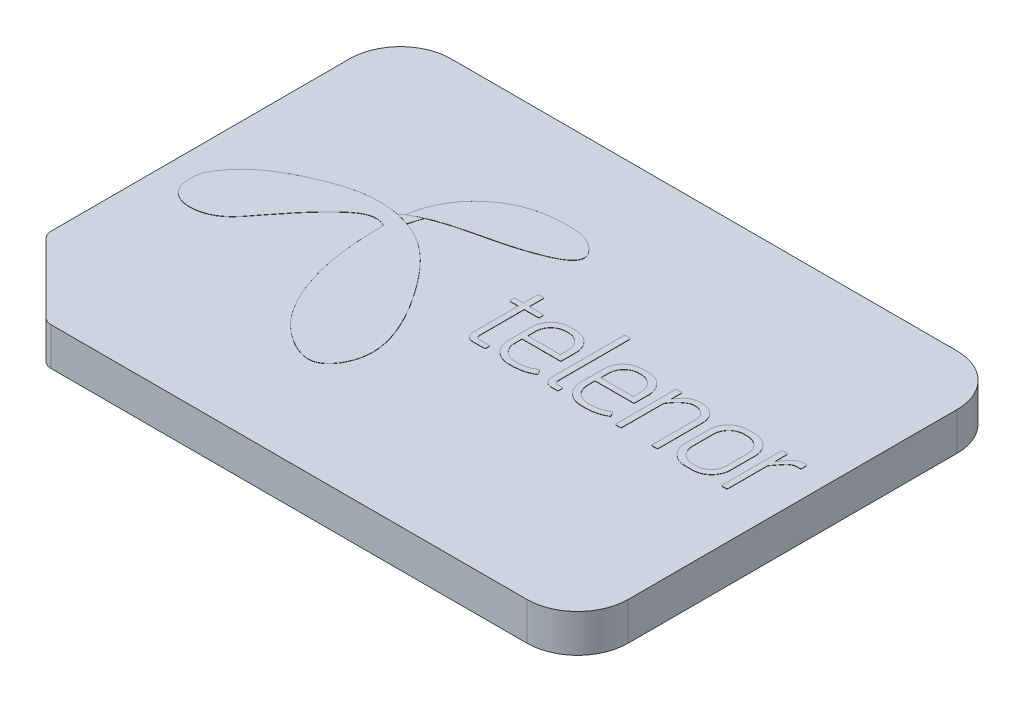
from build123d import *

# Parameters (mm, degrees)
BOSS_EXTRUDE1_DEPTH = 0.75
CUT_EXTRUDE1_DEPTH  = 0.01
SKETCH4_W           = 3.5
SKETCH4_H           = 2.5
BOSS_EXTRUDE2_DEPTH = 0.02
BOSS_EXTRUDE3_DEPTH = 0.005
BOSS_EXTRUDE4_DEPTH = 0.004
BOSS_EXTRUDE5_DEPTH = 0.005
FILLET1_START       = 0.75
FILLET1_DEPTH       = 0.0051251


with BuildPart() as part:
    # Sketch1 → Boss-Extrude1 (new body)
    with BuildSketch(Plane(origin=(0, 0, 0), x_dir=(1, 0, 0), z_dir=(0, 1, 0))):
        with BuildLine():
            Line((-5.867245437, -2.86539128), (-4.513692046, -4.21894467))
            ThreePointArc((-4.513692046, -4.21894467), (-4.432586209, -4.273137858), (-4.336915351, -4.292167975))
            Line((-4.336915351, -4.292167975), (5.059531259, -4.292167975))
            ThreePointArc((5.059531259, -4.292167975), (5.76663804, -3.999274756), (6.059531259, -3.292167975))
            Line((6.059531259, -3.292167975), (6.059531259, 3.207832025))
            ThreePointArc((6.059531259, 3.207832025), (5.76663804, 3.914938806), (5.059531259, 4.207832025))
            Line((5.059531259, 4.207832025), (-4.940468741, 4.207832025))
            ThreePointArc((-4.940468741, 4.207832025), (-5.647575522, 3.914938806), (-5.940468741, 3.207832025))
            Line((-5.940468741, 3.207832025), (-5.940468741, -2.688614584))
            ThreePointArc((-5.940468741, -2.688614584), (-5.921438624, -2.784285442), (-5.867245437, -2.86539128))
        make_face()
    extrude(amount=BOSS_EXTRUDE1_DEPTH)

    # Sketch2 → Cut-Extrude1 (cut)
    with BuildSketch(Plane.XZ):
        with BuildLine():
            Line((-4, 4), (4, 4))
            ThreePointArc((4, 4), (5.060660172, 3.560660172), (5.5, 2.5))
            Line((5.5, 2.5), (5.5, -2.5))
            ThreePointArc((5.5, -2.5), (5.060660172, -3.560660172), (4, -4))
            Line((4, -4), (-4, -4))
            ThreePointArc((-4, -4), (-5.060660172, -3.560660172), (-5.5, -2.5))
            Line((-5.5, -2.5), (-5.5, 2.5))
            ThreePointArc((-5.5, 2.5), (-5.060660172, 3.560660172), (-4, 4))
        make_face()
    extrude(amount=-CUT_EXTRUDE1_DEPTH, mode=Mode.SUBTRACT)

    # Sketch4 → Boss-Extrude2 (add)
    with BuildSketch(Plane.XZ.offset(-0.01)):
        with BuildLine():
            Line((-1, 2.05), (-1, 2.717157288))
            ThreePointArc((-1, 2.717157288), (-1.030448187, 2.87023066), (-1.117157288, 3))
            Line((-1.117157288, 3), (-1.482842712, 3.365685425))
            ThreePointArc((-1.482842712, 3.365685425), (-1.569551813, 3.495454764), (-1.6, 3.648528137))
            Line((-1.6, 3.648528137), (-1.6, 3.8))
            Line((-1.6, 3.8), (1.6, 3.8))
            Line((1.6, 3.8), (1.6, 3.648528137))
            ThreePointArc((1.6, 3.648528137), (1.569551813, 3.495454764), (1.482842712, 3.365685425))
            Line((1.482842712, 3.365685425), (1.117157288, 3))
            ThreePointArc((1.117157288, 3), (1.030448187, 2.87023066), (1, 2.717157288))
            Line((1, 2.717157288), (1, 2.05))
            ThreePointArc((1, 2.05), (1.117157288, 1.767157288), (1.4, 1.65))
            ThreePointArc((1.4, 1.65), (1.541421356, 1.591421356), (1.6, 1.45))
            Line((1.6, 1.45), (1.6, -1.45))
            ThreePointArc((1.6, -1.45), (1.541421356, -1.591421356), (1.4, -1.65))
            ThreePointArc((1.4, -1.65), (1.117157288, -1.767157288), (1, -2.05))
            Line((1, -2.05), (1, -2.717157288))
            ThreePointArc((1, -2.717157288), (1.030448187, -2.87023066), (1.117157288, -3))
            Line((1.117157288, -3), (1.482842712, -3.365685425))
            ThreePointArc((1.482842712, -3.365685425), (1.569551813, -3.495454764), (1.6, -3.648528137))
            Line((1.6, -3.648528137), (1.6, -3.8))
            Line((1.6, -3.8), (-1.6, -3.8))
            Line((-1.6, -3.8), (-1.6, -3.648528137))
            ThreePointArc((-1.6, -3.648528137), (-1.569551813, -3.495454764), (-1.482842712, -3.365685425))
            Line((-1.482842712, -3.365685425), (-1.117157288, -3))
            ThreePointArc((-1.117157288, -3), (-1.030448187, -2.87023066), (-1, -2.717157288))
            Line((-1, -2.717157288), (-1, -2.05))
            ThreePointArc((-1, -2.05), (-1.117157288, -1.767157288), (-1.4, -1.65))
            ThreePointArc((-1.4, -1.65), (-1.541421356, -1.591421356), (-1.6, -1.45))
            Line((-1.6, -1.45), (-1.6, 1.45))
            ThreePointArc((-1.6, 1.45), (-1.541421356, 1.591421356), (-1.4, 1.65))
            ThreePointArc((-1.4, 1.65), (-1.117157288, 1.767157288), (-1, 2.05))
        make_face()
        with BuildLine():
            Line((-1.2, 2.05), (-1.2, 2.634314575))
            ThreePointArc((-1.2, 2.634314575), (-1.230448187, 2.787387948), (-1.317157288, 2.917157288))
            Line((-1.317157288, 2.917157288), (-1.624264069, 3.224264069))
            ThreePointArc((-1.624264069, 3.224264069), (-1.75432772, 3.418918078), (-1.8, 3.648528137))
            Line((-1.8, 3.648528137), (-1.8, 3.8))
            Line((-1.8, 3.8), (-4, 3.8))
            ThreePointArc((-4, 3.8), (-4.919238816, 3.419238816), (-5.3, 2.5))
            Line((-5.3, 2.5), (-5.3, 1.45))
            Line((-5.3, 1.45), (-1.8, 1.45))
            ThreePointArc((-1.8, 1.45), (-1.682842712, 1.732842712), (-1.4, 1.85))
            ThreePointArc((-1.4, 1.85), (-1.258578644, 1.908578644), (-1.2, 2.05))
        make_face()
        with Locations((-3.55, 0)):
            Rectangle(SKETCH4_W, SKETCH4_H)
        with BuildLine():
            Line((-5.3, -1.45), (-1.8, -1.45))
            ThreePointArc((-1.8, -1.45), (-1.682842712, -1.732842712), (-1.4, -1.85))
            ThreePointArc((-1.4, -1.85), (-1.258578644, -1.908578644), (-1.2, -2.05))
            Line((-1.2, -2.05), (-1.2, -2.634314575))
            ThreePointArc((-1.2, -2.634314575), (-1.230448187, -2.787387948), (-1.317157288, -2.917157288))
            Line((-1.317157288, -2.917157288), (-1.624264069, -3.224264069))
            ThreePointArc((-1.624264069, -3.224264069), (-1.75432772, -3.418918078), (-1.8, -3.648528137))
            Line((-1.8, -3.648528137), (-1.8, -3.8))
            Line((-1.8, -3.8), (-4, -3.8))
            ThreePointArc((-4, -3.8), (-4.919238816, -3.419238816), (-5.3, -2.5))
            Line((-5.3, -2.5), (-5.3, -1.45))
        make_face()
        with Locations((3.55, 0)):
            Rectangle(SKETCH4_W, SKETCH4_H)
        with BuildLine():
            Line((4, 3.8), (1.8, 3.8))
            Line((1.8, 3.8), (1.8, 3.648528137))
            ThreePointArc((1.8, 3.648528137), (1.75432772, 3.418918078), (1.624264069, 3.224264069))
            Line((1.624264069, 3.224264069), (1.317157288, 2.917157288))
            ThreePointArc((1.317157288, 2.917157288), (1.230448187, 2.787387948), (1.2, 2.634314575))
            Line((1.2, 2.634314575), (1.2, 2.05))
            ThreePointArc((1.2, 2.05), (1.258578644, 1.908578644), (1.4, 1.85))
            ThreePointArc((1.4, 1.85), (1.682842712, 1.732842712), (1.8, 1.45))
            Line((1.8, 1.45), (5.3, 1.45))
            Line((5.3, 1.45), (5.3, 2.5))
            ThreePointArc((5.3, 2.5), (4.919238816, 3.419238816), (4, 3.8))
        make_face()
        with BuildLine():
            Line((1.8, -3.8), (1.8, -3.648528137))
            ThreePointArc((1.8, -3.648528137), (1.75432772, -3.418918078), (1.624264069, -3.224264069))
            Line((1.624264069, -3.224264069), (1.317157288, -2.917157288))
            ThreePointArc((1.317157288, -2.917157288), (1.230448187, -2.787387948), (1.2, -2.634314575))
            Line((1.2, -2.634314575), (1.2, -2.05))
            ThreePointArc((1.2, -2.05), (1.258578644, -1.908578644), (1.4, -1.85))
            ThreePointArc((1.4, -1.85), (1.682842712, -1.732842712), (1.8, -1.45))
            Line((1.8, -1.45), (5.3, -1.45))
            Line((5.3, -1.45), (5.3, -2.5))
            ThreePointArc((5.3, -2.5), (4.919238816, -3.419238816), (4, -3.8))
            Line((4, -3.8), (1.8, -3.8))
        make_face()
    extrude(amount=BOSS_EXTRUDE2_DEPTH)

    # Sketch5 → Boss-Extrude3 (add)
    with BuildSketch(Plane(origin=(0, 0.75, 0), x_dir=(1, 0, 0), z_dir=(0, 1, 0))):
        with BuildLine():
            add(Edge.make_bspline(
                [(-2.746331249, 0.684151864), (-3.018239989, 0.82701914), (-3.564683242, 0.386731617), (-4.05681354, -0.232269927), (-4.67686219, -1.065183577), (-5.618099933, -0.941053145), (-5.431270149, -0.191830215)],
                knots=[0, 0, 0, 0, 0.204670793, 0.494379641, 0.653658296, 1, 1, 1, 1], degree=3))
            add(Edge.make_bspline(
                [(-5.431270149, -0.191830215), (-5.183392045, 0.308508675), (-4.445277857, 0.755332819), (-3.300795452, 1.142116003), (-2.15051283, 0.908557653), (-1.411768103, 0.052654454), (-0.833611503, -0.851243738), (-0.550300398, -1.729511808), (-1.083605068, -2.476394517), (-1.92229722, -2.096853033), (-2.621963661, -1.065535594), (-2.756354926, 0.025473446), (-2.746331249, 0.684151864)],
                knots=[0, 0, 0, 0, 0.143633998, 0.224551072, 0.32123149, 0.437928053, 0.514752059, 0.615897368, 0.662761045, 0.721217283, 0.819471934, 1, 1, 1, 1], degree=3))
        make_face()
        with BuildLine():
            add(Edge.make_bspline(
                [(-2.712331134, 1.088175469), (-2.322338812, 1.32598895), (-1.589483323, 1.458701264), (-0.82208368, 1.67013018), (-0.236360501, 1.920399994), (-0.193397974, 2.199987102), (-0.479535569, 2.492310562), (-1.1728854, 2.528715404), (-2.062599411, 2.345058126), (-2.654117546, 1.618896722), (-2.712331134, 1.08875865)],
                knots=[0.021028627, 0.021028627, 0.021028627, 0.021028627, 0.247946457, 0.361228738, 0.459844615, 0.477083349, 0.533616079, 0.606189141, 0.770601523, 1, 1, 1, 1], degree=3))
            Line((-2.712331134, 1.08875865), (-2.712331134, 1.088175469))
        make_face()
    extrude(amount=BOSS_EXTRUDE3_DEPTH)

    # Sketch7 → Boss-Extrude4 (add)
    with BuildSketch(Plane(origin=(0, 0.75, 0), x_dir=(1, 0, 0), z_dir=(0, 1, 0))):
        with BuildLine():
            add(Edge.make_bspline(
                [(-2.465592891, 1.215197057), (-2.513475678, 1.081757888), (-2.547122699, 0.944087382)],
                knots=[0, 0, 0, 1, 1, 1], degree=2))
            add(Edge.make_bspline(
                [(-2.818079937, 1.018084297), (-2.726042248, 0.999926402), (-2.635285786, 0.975200652), (-2.547122699, 0.944087382)],
                knots=[0.271335943, 0.271335943, 0.271335943, 0.271335943, 0.296118168, 0.296118168, 0.296118168, 0.296118168], degree=3))
            add(Edge.make_bspline(
                [(-2.818079937, 1.018084297), (-2.709072986, 1.096648665), (-2.590215165, 1.160965408), (-2.465592891, 1.215197057)],
                knots=[0, 0, 0, 0, 0.066799043, 0.066799043, 0.066799043, 0.066799043], degree=3))
        make_face()
    extrude(amount=BOSS_EXTRUDE4_DEPTH)

    # Sketch8 → Boss-Extrude5 (add)
    # profile 1 of 7: a face of its own
    with BuildSketch(Plane(origin=(0, 0.75, 0), x_dir=(1, 0, 0), z_dir=(0, 1, 0))):
        with BuildLine():
            Line((-0.039842098, 1.033211986), (-0.039842098, 0.738024425))
            Line((-0.039842098, 0.738024425), (-0.216792351, 0.738024425))
            Line((-0.216792351, 0.738024425), (-0.216792351, 0.637717972))
            Line((-0.216792351, 0.637717972), (-0.039842098, 0.637717972))
            Line((-0.039842098, 0.637717972), (-0.039842098, -0.26479863))
            ThreePointArc((-0.039842098, -0.26479863), (0.005556351, -0.374400181), (0.115157902, -0.41979863))
            Line((0.115157902, -0.41979863), (0.361847188, -0.41979863))
            Line((0.361847188, -0.41979863), (0.361847188, -0.322574834))
            Line((0.361847188, -0.322574834), (0.15339521, -0.322574834))
            ThreePointArc((0.15339521, -0.322574834), (0.100362202, -0.300607843), (0.07839521, -0.247574834))
            Line((0.07839521, -0.247574834), (0.07839521, 0.637717972))
            Line((0.07839521, 0.637717972), (0.367850974, 0.637717972))
            Line((0.367850974, 0.637717972), (0.367850974, 0.738024425))
            Line((0.367850974, 0.738024425), (0.07839521, 0.738024425))
            Line((0.07839521, 0.738024425), (0.07839521, 1.033211986))
            Line((0.07839521, 1.033211986), (-0.039842098, 1.033211986))
        make_face()
    # profile 2 of 7: a face of its own
    with BuildSketch(Plane(origin=(0, 0.75, 0), x_dir=(1, 0, 0), z_dir=(0, 1, 0))):
        with BuildLine():
            Line((0.560548029, 0.112189616), (1.325341981, 0.112189616))
            Line((1.325341981, 0.112189616), (1.325341981, 0.413114254))
            ThreePointArc((1.325341981, 0.413114254), (1.215507024, 0.678279297), (0.950341981, 0.788114254))
            Line((0.950341981, 0.788114254), (0.823262051, 0.788114254))
            ThreePointArc((0.823262051, 0.788114254), (0.558097008, 0.678279297), (0.448262051, 0.413114254))
            Line((0.448262051, 0.413114254), (0.448262051, -0.04677698))
            ThreePointArc((0.448262051, -0.04677698), (0.565419338, -0.329619693), (0.848262051, -0.44677698))
            Line((0.848262051, -0.44677698), (0.958233671, -0.44677698))
            add(Edge.make_bspline(
                [(0.958233671, -0.44677698), (1.090913429, -0.441307073), (1.214307268, -0.409288639), (1.324989539, -0.33683287)],
                knots=[0, 0, 0, 0, 1, 1, 1, 1], degree=3))
            Line((1.324989539, -0.33683287), (1.265309096, -0.237412416))
            add(Edge.make_bspline(
                [(0.860548029, -0.339308184), (1.079180057, -0.362555739), (1.265309096, -0.237412416)],
                knots=[0, 0, 0, 1, 1, 1], degree=2))
            ThreePointArc((0.860548029, -0.339308184), (0.648415995, -0.251440218), (0.560548029, -0.039308184))
            Line((0.560548029, -0.039308184), (0.560548029, 0.112189616))
        make_face()
        with BuildLine():
            Line((0.562831822, 0.221265893), (1.206858226, 0.221265893))
            Line((1.206858226, 0.221265893), (1.206858226, 0.378011969))
            ThreePointArc((1.206858226, 0.378011969), (1.118990261, 0.590144004), (0.906858226, 0.678011969))
            Line((0.906858226, 0.678011969), (0.862831822, 0.678011969))
            ThreePointArc((0.862831822, 0.678011969), (0.650699788, 0.590144004), (0.562831822, 0.378011969))
            Line((0.562831822, 0.378011969), (0.562831822, 0.221265893))
        make_face(mode=Mode.SUBTRACT)
    # profile 3 of 7: a face of its own
    with BuildSketch(Plane(origin=(0, 0.75, 0), x_dir=(1, 0, 0), z_dir=(0, 1, 0))):
        with BuildLine():
            Line((1.507907198, 1.192098568), (1.507907198, -0.26183691))
            ThreePointArc((1.507907198, -0.26183691), (1.554770113, -0.374973995), (1.667907198, -0.42183691))
            Line((1.667907198, -0.42183691), (1.803911943, -0.42183691))
            Line((1.803911943, -0.42183691), (1.803911943, -0.321909948))
            Line((1.803911943, -0.321909948), (1.704707185, -0.321909948))
            ThreePointArc((1.704707185, -0.321909948), (1.651674176, -0.299942956), (1.629707185, -0.246909948))
            Line((1.629707185, -0.246909948), (1.629707185, 1.192098568))
            Line((1.629707185, 1.192098568), (1.507907198, 1.192098568))
        make_face()
    # profile 4 of 7: a face of its own
    with BuildSketch(Plane(origin=(0, 0.75, 0), x_dir=(1, 0, 0), z_dir=(0, 1, 0))):
        with BuildLine():
            Line((2.941202589, 0.777370173), (2.941202589, -0.430933078))
            Line((2.941202589, -0.430933078), (3.060921969, -0.430933078))
            Line((3.060921969, -0.430933078), (3.060921969, 0.408363321))
            add(Edge.make_bspline(
                [(3.060921969, 0.408363321), (3.118709934, 0.500241405), (3.216691387, 0.622693218), (3.356731553, 0.677710895), (3.395041539, 0.678497314)],
                knots=[0, 0, 0, 0, 0.750567643, 1, 1, 1, 1], degree=3))
            Line((3.395041539, 0.678497314), (3.4256973, 0.678497314))
            ThreePointArc((3.4256973, 0.678497314), (3.58833186, 0.611131874), (3.6556973, 0.448497314))
            Line((3.6556973, 0.448497314), (3.6556973, -0.430933078))
            Line((3.6556973, -0.430933078), (3.778927534, -0.430933078))
            Line((3.778927534, -0.430933078), (3.778927534, 0.467379625))
            ThreePointArc((3.778927534, 0.467379625), (3.685201704, 0.693653795), (3.458927534, 0.787379625))
            Line((3.458927534, 0.787379625), (3.395041539, 0.787379625))
            add(Edge.make_bspline(
                [(3.060921969, 0.558322596), (3.112328489, 0.638924754), (3.21551659, 0.758180908), (3.353259431, 0.785707111), (3.395041539, 0.787379625)],
                knots=[0, 0, 0, 0, 0.714397336, 1, 1, 1, 1], degree=3))
            Line((3.060921969, 0.558322596), (3.060921969, 0.777370173))
            Line((3.060921969, 0.777370173), (2.941202589, 0.777370173))
        make_face()
    # profile 5 of 7: a face of its own
    with BuildSketch(Plane(origin=(0, 0.75, 0), x_dir=(1, 0, 0), z_dir=(0, 1, 0))):
        with BuildLine():
            Line((1.997875049, 0.116111152), (2.767209177, 0.116111152))
            Line((2.767209177, 0.116111152), (2.767209177, 0.410738787))
            ThreePointArc((2.767209177, 0.410738787), (2.65737422, 0.67590383), (2.392209177, 0.785738787))
            Line((2.392209177, 0.785738787), (2.253611647, 0.785738787))
            ThreePointArc((2.253611647, 0.785738787), (1.988446604, 0.67590383), (1.878611647, 0.410738787))
            Line((1.878611647, 0.410738787), (1.878611647, -0.042855444))
            ThreePointArc((1.878611647, -0.042855444), (1.995768935, -0.325698156), (2.278611647, -0.442855444))
            Line((2.278611647, -0.442855444), (2.395560691, -0.442855444))
            add(Edge.make_bspline(
                [(2.395560691, -0.442855444), (2.528240449, -0.437385537), (2.651634287, -0.405367103), (2.762316558, -0.332911334)],
                knots=[0, 0, 0, 0, 1, 1, 1, 1], degree=3))
            Line((2.762316558, -0.332911334), (2.702636115, -0.23349088))
            add(Edge.make_bspline(
                [(2.297875049, -0.335386648), (2.516507077, -0.358634203), (2.702636115, -0.23349088)],
                knots=[0, 0, 0, 1, 1, 1], degree=2))
            ThreePointArc((2.297875049, -0.335386648), (2.085743014, -0.247518682), (1.997875049, -0.035386648))
            Line((1.997875049, -0.035386648), (1.997875049, 0.116111152))
        make_face()
        with BuildLine():
            Line((2.000158842, 0.225187429), (2.644185246, 0.225187429))
            Line((2.644185246, 0.225187429), (2.644185246, 0.381933505))
            ThreePointArc((2.644185246, 0.381933505), (2.55631728, 0.59406554), (2.344185246, 0.681933505))
            Line((2.344185246, 0.681933505), (2.300158842, 0.681933505))
            ThreePointArc((2.300158842, 0.681933505), (2.088026807, 0.59406554), (2.000158842, 0.381933505))
            Line((2.000158842, 0.381933505), (2.000158842, 0.225187429))
        make_face(mode=Mode.SUBTRACT)
    # profile 6 of 7: a face of its own
    with BuildSketch(Plane(origin=(0, 0.75, 0), x_dir=(1, 0, 0), z_dir=(0, 1, 0))):
        with BuildLine():
            Line((4.333242587, -0.446302445), (4.488491677, -0.446302445))
            ThreePointArc((4.488491677, -0.446302445), (4.75365672, -0.336467488), (4.863491677, -0.071302445))
            Line((4.863491677, -0.071302445), (4.863491677, 0.412603377))
            ThreePointArc((4.863491677, 0.412603377), (4.75365672, 0.67776842), (4.488491677, 0.787603377))
            Line((4.488491677, 0.787603377), (4.333242587, 0.787603377))
            ThreePointArc((4.333242587, 0.787603377), (4.068077544, 0.67776842), (3.958242587, 0.412603377))
            Line((3.958242587, 0.412603377), (3.958242587, -0.071302445))
            ThreePointArc((3.958242587, -0.071302445), (4.068077544, -0.336467488), (4.333242587, -0.446302445))
        make_face()
        with BuildLine():
            Line((4.376970761, -0.341069535), (4.450508506, -0.341069535))
            ThreePointArc((4.450508506, -0.341069535), (4.66264054, -0.253201569), (4.750508506, -0.041069535))
            Line((4.750508506, -0.041069535), (4.750508506, 0.376191119))
            ThreePointArc((4.750508506, 0.376191119), (4.66264054, 0.588323153), (4.450508506, 0.676191119))
            Line((4.450508506, 0.676191119), (4.376970761, 0.676191119))
            ThreePointArc((4.376970761, 0.676191119), (4.164838727, 0.588323153), (4.076970761, 0.376191119))
            Line((4.076970761, 0.376191119), (4.076970761, -0.041069535))
            ThreePointArc((4.076970761, -0.041069535), (4.164838727, -0.253201569), (4.376970761, -0.341069535))
        make_face(mode=Mode.SUBTRACT)
    # profile 7 of 7: a face of its own
    with BuildSketch(Plane(origin=(0, 0.75, 0), x_dir=(1, 0, 0), z_dir=(0, 1, 0))):
        with BuildLine():
            Line((5.036884024, 0.774620354), (5.036884024, -0.430933078))
            Line((5.036884024, -0.430933078), (5.154267175, -0.430933078))
            Line((5.154267175, -0.430933078), (5.154267175, 0.371581106))
            add(Edge.make_bspline(
                [(5.154267175, 0.371581106), (5.183138804, 0.411279595), (5.273529052, 0.527781971), (5.364208366, 0.643181288), (5.467307065, 0.640869357)],
                knots=[0, 0, 0, 0, 0.369783339, 1, 1, 1, 1], degree=3))
            Line((5.467307065, 0.640869357), (5.538328302, 0.640869357))
            Line((5.538328302, 0.640869357), (5.538328302, 0.770569729))
            Line((5.538328302, 0.770569729), (5.441336015, 0.770569729))
            add(Edge.make_bspline(
                [(5.154267175, 0.507498373), (5.235787142, 0.601114742), (5.297522185, 0.756491916), (5.441336015, 0.770569729)],
                knots=[0, 0, 0, 0, 1, 1, 1, 1], degree=3))
            Line((5.154267175, 0.507498373), (5.154267175, 0.774620354))
            Line((5.154267175, 0.774620354), (5.036884024, 0.774620354))
        make_face()
    extrude(amount=BOSS_EXTRUDE5_DEPTH)

    # Fillet1: read off the stored shape, not the designer's step
    # Fillet1 outline → Fillet1 (cut)
    with BuildSketch(Plane(origin=(0, 0, 0), x_dir=(1, 0, 0), z_dir=(0, 1, 0)).offset(FILLET1_START)):
        with BuildLine():
            Line((5.154267175, -0.430933078), (5.154267175, -0.415933078))
            add(Edge.make_bspline(
                [(5.154267175, -0.415933078), (5.154267175, -0.430933078), (5.124267175, -0.430933078)],
                knots=[0, 0, 0, 1, 1, 1], degree=2, weights=[1, 0.707106781, 1]))
            Line((5.124267175, -0.430933078), (5.154267175, -0.430933078))
        make_face()
        with BuildLine():
            Line((5.036884024, -0.430933078), (5.066884024, -0.430933078))
            add(Edge.make_bspline(
                [(5.066884024, -0.430933078), (5.036884024, -0.430933078), (5.036884024, -0.415933078)],
                knots=[0, 0, 0, 1, 1, 1], degree=2, weights=[1, 0.707106781, 1]))
            Line((5.036884024, -0.415933078), (5.036884024, -0.430933078))
        make_face()
        with BuildLine():
            add(Edge.make_bspline(
                [(5.538328302, 0.670869357), (5.538328302, 0.640869357), (5.523328302, 0.640869357)],
                knots=[0, 0, 0, 1, 1, 1], degree=2, weights=[1, 0.707106781, 1]))
            Line((5.523328302, 0.640869357), (5.538328302, 0.640869357))
            Line((5.538328302, 0.640869357), (5.538328302, 0.670869357))
        make_face()
        with BuildLine():
            Line((5.036884024, 0.774620354), (5.036884024, 0.759620354))
            add(Edge.make_bspline(
                [(5.036884024, 0.759620354), (5.036884024, 0.774620354), (5.066884024, 0.774620354)],
                knots=[0, 0, 0, 1, 1, 1], degree=2, weights=[1, 0.707106781, 1]))
            Line((5.066884024, 0.774620354), (5.036884024, 0.774620354))
        make_face()
        with BuildLine():
            add(Edge.make_bspline(
                [(5.523328302, 0.770569729), (5.538328302, 0.770569729), (5.538328302, 0.740569729)],
                knots=[0, 0, 0, 1, 1, 1], degree=2, weights=[1, 0.707106781, 1]))
            Line((5.538328302, 0.740569729), (5.538328302, 0.770569729))
            Line((5.538328302, 0.770569729), (5.523328302, 0.770569729))
        make_face()
        with BuildLine():
            Line((5.154267175, 0.774620354), (5.124267175, 0.774620354))
            add(Edge.make_bspline(
                [(5.124267175, 0.774620354), (5.154267175, 0.774620354), (5.154267175, 0.759620354)],
                knots=[0, 0, 0, 1, 1, 1], degree=2, weights=[1, 0.707106781, 1]))
            Line((5.154267175, 0.759620354), (5.154267175, 0.774620354))
        make_face()
        with BuildLine():
            Line((2.941202589, 0.777370173), (2.941202589, 0.762370173))
            add(Edge.make_bspline(
                [(2.941202589, 0.762370173), (2.941202589, 0.777370173), (2.971202589, 0.777370173)],
                knots=[0, 0, 0, 1, 1, 1], degree=2, weights=[1, 0.707106781, 1]))
            Line((2.971202589, 0.777370173), (2.941202589, 0.777370173))
        make_face()
        with BuildLine():
            add(Edge.make_bspline(
                [(3.060921969, -0.415933078), (3.060921969, -0.430933078), (3.030921969, -0.430933078)],
                knots=[0, 0, 0, 1, 1, 1], degree=2, weights=[1, 0.707106781, 1]))
            Line((3.030921969, -0.430933078), (3.060921969, -0.430933078))
            Line((3.060921969, -0.430933078), (3.060921969, -0.415933078))
        make_face()
        with BuildLine():
            add(Edge.make_bspline(
                [(2.971202589, -0.430933078), (2.941202589, -0.430933078), (2.941202589, -0.415933078)],
                knots=[0, 0, 0, 1, 1, 1], degree=2, weights=[1, 0.707106781, 1]))
            Line((2.941202589, -0.415933078), (2.941202589, -0.430933078))
            Line((2.941202589, -0.430933078), (2.971202589, -0.430933078))
        make_face()
        with BuildLine():
            Line((3.060921969, 0.777370173), (3.030921969, 0.777370173))
            add(Edge.make_bspline(
                [(3.030921969, 0.777370173), (3.060921969, 0.777370173), (3.060921969, 0.762370173)],
                knots=[0, 0, 0, 1, 1, 1], degree=2, weights=[1, 0.707106781, 1]))
            Line((3.060921969, 0.762370173), (3.060921969, 0.777370173))
        make_face()
        with BuildLine():
            Line((3.778927534, -0.430933078), (3.778927534, -0.415933078))
            add(Edge.make_bspline(
                [(3.778927534, -0.415933078), (3.778927534, -0.430933078), (3.748927534, -0.430933078)],
                knots=[0, 0, 0, 1, 1, 1], degree=2, weights=[1, 0.707106781, 1]))
            Line((3.748927534, -0.430933078), (3.778927534, -0.430933078))
        make_face()
        with BuildLine():
            Line((3.6556973, -0.430933078), (3.6856973, -0.430933078))
            add(Edge.make_bspline(
                [(3.6856973, -0.430933078), (3.6556973, -0.430933078), (3.6556973, -0.415933078)],
                knots=[0, 0, 0, 1, 1, 1], degree=2, weights=[1, 0.707106781, 1]))
            Line((3.6556973, -0.415933078), (3.6556973, -0.430933078))
        make_face()
        with BuildLine():
            Line((1.507907198, 1.192098568), (1.507907198, 1.177098568))
            add(Edge.make_bspline(
                [(1.507907198, 1.177098568), (1.507907198, 1.192098568), (1.537907198, 1.192098568)],
                knots=[0, 0, 0, 1, 1, 1], degree=2, weights=[1, 0.707106781, 1]))
            Line((1.537907198, 1.192098568), (1.507907198, 1.192098568))
        make_face()
        with BuildLine():
            Line((1.629707185, 1.192098568), (1.599707185, 1.192098568))
            add(Edge.make_bspline(
                [(1.599707185, 1.192098568), (1.629707185, 1.192098568), (1.629707185, 1.177098568)],
                knots=[0, 0, 0, 1, 1, 1], degree=2, weights=[1, 0.707106781, 1]))
            Line((1.629707185, 1.177098568), (1.629707185, 1.192098568))
        make_face()
        with BuildLine():
            add(Edge.make_bspline(
                [(2.702636115, -0.23349088), (2.69602061, -0.237938796), (2.689364045, -0.242199253)],
                knots=[0, 0, 0, 0.035542573, 0.035542573, 0.035542573], degree=2))
            add(Edge.make_bspline(
                [(2.689364045, -0.242199253), (2.702728806, -0.233645293), (2.71839713, -0.259746839)],
                knots=[0, 0, 0, 1, 1, 1], degree=2, weights=[1, 0.696882821, 1]))
            Line((2.71839713, -0.259746839), (2.702636115, -0.23349088))
        make_face()
        with BuildLine():
            Line((2.762316558, -0.332911334), (2.747085229, -0.307537769))
            add(Edge.make_bspline(
                [(2.747085229, -0.307537769), (2.762401177, -0.333052299), (2.750083523, -0.340723343)],
                knots=[0, 0, 0, 1, 1, 1], degree=2, weights=[1, 0.712868967, 1]))
            add(Edge.make_bspline(
                [(2.750083523, -0.340723343), (2.754178198, -0.33817331), (2.758255933, -0.335569535), (2.762316558, -0.332911334)],
                knots=[0.963312775, 0.963312775, 0.963312775, 0.963312775, 1, 1, 1, 1], degree=3))
        make_face()
        with BuildLine():
            Line((1.803911943, -0.42183691), (1.803911943, -0.39183691))
            add(Edge.make_bspline(
                [(1.803911943, -0.39183691), (1.803911943, -0.42183691), (1.788911943, -0.42183691)],
                knots=[0, 0, 0, 1, 1, 1], degree=2, weights=[1, 0.707106781, 1]))
            Line((1.788911943, -0.42183691), (1.803911943, -0.42183691))
        make_face()
        with BuildLine():
            add(Edge.make_bspline(
                [(1.788911943, -0.321909948), (1.803911943, -0.321909948), (1.803911943, -0.351909948)],
                knots=[0, 0, 0, 1, 1, 1], degree=2, weights=[1, 0.707106781, 1]))
            Line((1.803911943, -0.351909948), (1.803911943, -0.321909948))
            Line((1.803911943, -0.321909948), (1.788911943, -0.321909948))
        make_face()
        with BuildLine():
            add(Edge.make_bspline(
                [(1.265309096, -0.237412416), (1.258693591, -0.241860332), (1.252037025, -0.246120789)],
                knots=[0, 0, 0, 0.035542573, 0.035542573, 0.035542573], degree=2))
            add(Edge.make_bspline(
                [(1.252037025, -0.246120789), (1.265401787, -0.237566829), (1.281070111, -0.263668375)],
                knots=[0, 0, 0, 1, 1, 1], degree=2, weights=[1, 0.696882821, 1]))
            Line((1.281070111, -0.263668375), (1.265309096, -0.237412416))
        make_face()
        with BuildLine():
            Line((1.324989539, -0.33683287), (1.30975821, -0.311459305))
            add(Edge.make_bspline(
                [(1.30975821, -0.311459305), (1.325074157, -0.336973835), (1.312756504, -0.344644879)],
                knots=[0, 0, 0, 1, 1, 1], degree=2, weights=[1, 0.712868967, 1]))
            add(Edge.make_bspline(
                [(1.312756504, -0.344644879), (1.316851178, -0.342094846), (1.320928913, -0.339491071), (1.324989539, -0.33683287)],
                knots=[0.963312775, 0.963312775, 0.963312775, 0.963312775, 1, 1, 1, 1], degree=3))
        make_face()
        with BuildLine():
            Line((-0.216792351, 0.738024425), (-0.216792351, 0.708024425))
            add(Edge.make_bspline(
                [(-0.216792351, 0.708024425), (-0.216792351, 0.738024425), (-0.201792351, 0.738024425)],
                knots=[0, 0, 0, 1, 1, 1], degree=2, weights=[1, 0.707106781, 1]))
            Line((-0.201792351, 0.738024425), (-0.216792351, 0.738024425))
        make_face()
        with BuildLine():
            add(Edge.make_bspline(
                [(-0.201792351, 0.637717972), (-0.216792351, 0.637717972), (-0.216792351, 0.667717972)],
                knots=[0, 0, 0, 1, 1, 1], degree=2, weights=[1, 0.707106781, 1]))
            Line((-0.216792351, 0.667717972), (-0.216792351, 0.637717972))
            Line((-0.216792351, 0.637717972), (-0.201792351, 0.637717972))
        make_face()
        with BuildLine():
            Line((0.367850974, 0.637717972), (0.367850974, 0.667717972))
            add(Edge.make_bspline(
                [(0.367850974, 0.667717972), (0.367850974, 0.637717972), (0.352850974, 0.637717972)],
                knots=[0, 0, 0, 1, 1, 1], degree=2, weights=[1, 0.707106781, 1]))
            Line((0.352850974, 0.637717972), (0.367850974, 0.637717972))
        make_face()
        with BuildLine():
            Line((0.367850974, 0.738024425), (0.352850974, 0.738024425))
            add(Edge.make_bspline(
                [(0.352850974, 0.738024425), (0.367850974, 0.738024425), (0.367850974, 0.708024425)],
                knots=[0, 0, 0, 1, 1, 1], degree=2, weights=[1, 0.707106781, 1]))
            Line((0.367850974, 0.708024425), (0.367850974, 0.738024425))
        make_face()
        with BuildLine():
            Line((0.07839521, 1.033211986), (0.04839521, 1.033211986))
            add(Edge.make_bspline(
                [(0.04839521, 1.033211986), (0.07839521, 1.033211986), (0.07839521, 1.018211986)],
                knots=[0, 0, 0, 1, 1, 1], degree=2, weights=[1, 0.707106781, 1]))
            Line((0.07839521, 1.018211986), (0.07839521, 1.033211986))
        make_face()
        with BuildLine():
            Line((-0.039842098, 1.033211986), (-0.039842098, 1.018211986))
            add(Edge.make_bspline(
                [(-0.039842098, 1.018211986), (-0.039842098, 1.033211986), (-0.009842098, 1.033211986)],
                knots=[0, 0, 0, 1, 1, 1], degree=2, weights=[1, 0.707106781, 1]))
            Line((-0.009842098, 1.033211986), (-0.039842098, 1.033211986))
        make_face()
        with BuildLine():
            Line((0.361847188, -0.41979863), (0.361847188, -0.38979863))
            add(Edge.make_bspline(
                [(0.361847188, -0.38979863), (0.361847188, -0.41979863), (0.346847188, -0.41979863)],
                knots=[0, 0, 0, 1, 1, 1], degree=2, weights=[1, 0.707106781, 1]))
            Line((0.346847188, -0.41979863), (0.361847188, -0.41979863))
        make_face()
        with BuildLine():
            add(Edge.make_bspline(
                [(0.346847188, -0.322574834), (0.361847188, -0.322574834), (0.361847188, -0.352574834)],
                knots=[0, 0, 0, 1, 1, 1], degree=2, weights=[1, 0.707106781, 1]))
            Line((0.361847188, -0.352574834), (0.361847188, -0.322574834))
            Line((0.361847188, -0.322574834), (0.346847188, -0.322574834))
        make_face()
    extrude(amount=FILLET1_DEPTH, mode=Mode.SUBTRACT)


solid = part.part
